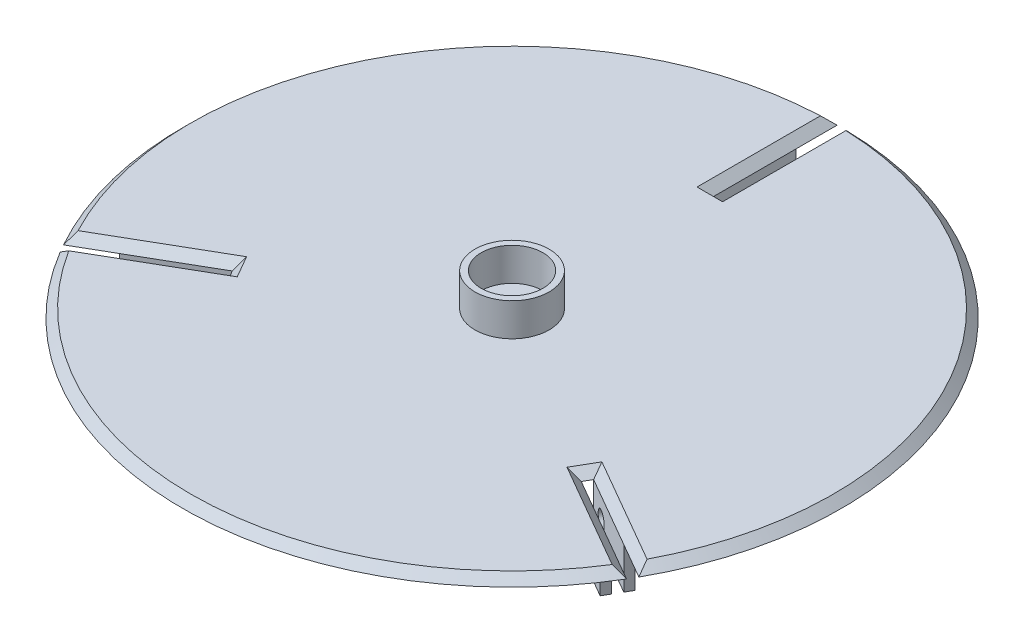
from build123d import *

# Parameters (mm, degrees)
BOSS_EXTRUDE1_DEPTH = 2
BOSS_EXTRUDE1_DRAFT = 45
SKETCH2_R           = 2.5
CUT_EXTRUDE1_DEPTH  = 114.154761278
SKETCH3_R           = 9
SKETCH3_R_2         = 7.5
BOSS_EXTRUDE2_DEPTH = 8
SKETCH4_W           = 2
SKETCH4_H           = 20
BOSS_EXTRUDE3_DEPTH = 10
SKETCH5_R           = 2
CUT_EXTRUDE2_DEPTH  = 10
CIRPATTERN1_COUNT   = 3


# Read off the part's stored shape, not the designer's step: Boss-Extrude1
with BuildPart() as part:
    # Boss-Extrude1 outline → Boss-Extrude1 (with draft: the straight prism first)
    with BuildSketch(Plane(origin=(0, 2, 0), x_dir=(1, 0, 0), z_dir=(0, 1, 0))):
        with BuildLine():
            ThreePointArc((-3.1, 77.938373091), (-67.549981495, 39), (-69.046611026, -36.284507794))
            Line((-69.046611026, -36.284507794), (-43.119219382, -21.315321248))
            Line((-43.119219382, -21.315321248), (-40.019219382, -26.684678752))
            Line((-40.019219382, -26.684678752), (-65.946611026, -41.653865297))
            ThreePointArc((-65.946611026, -41.653865297), (0, -78), (65.946611026, -41.653865297))
            Line((65.946611026, -41.653865297), (40.019219382, -26.684678752))
            Line((40.019219382, -26.684678752), (43.119219382, -21.315321248))
            Line((43.119219382, -21.315321248), (69.046611026, -36.284507794))
            ThreePointArc((69.046611026, -36.284507794), (67.549981495, 39), (3.1, 77.938373091))
            Line((3.1, 77.938373091), (3.1, 48))
            Line((3.1, 48), (-3.1, 48))
            Line((-3.1, 48), (-3.1, 77.938373091))
        make_face()
    extrude(amount=-BOSS_EXTRUDE1_DEPTH)
    # Boss-Extrude1: the draft: its side faces are tilted about the plane it starts from
    boss_extrude1_sides = [part.faces().sort_by_distance(p)[0] for p in [
        (67.549981495, 1, -39),
        (3.1, 1, -62.969186546),
        (0, 1, -48),
        (-3.1, 1, -62.969186546),
        (-67.549981495, 1, -39),
        (-56.082915204, 1, 28.799914521),
        (-41.569219382, 1, 24),
        (-52.982915204, 1, 34.169272025),
        (0, 1, 78),
        (52.982915204, 1, 34.169272025),
        (41.569219382, 1, 24),
        (56.082915204, 1, 28.799914521),
    ]]
    draft(boss_extrude1_sides, Plane(origin=(0, 2, 0), x_dir=(1, 0, 0), z_dir=(0, 1, 0)), BOSS_EXTRUDE1_DRAFT)

    # Sketch2 → Cut-Extrude1 (cut, through all)
    with BuildSketch(Plane(origin=(0, 2, 0), x_dir=(1, 0, 0), z_dir=(0, 1, 0))):
        with Locations(Location((0, 0, 0), (0, 0, 270))):
            Circle(SKETCH2_R)
    extrude(amount=-CUT_EXTRUDE1_DEPTH, mode=Mode.SUBTRACT)

    # Sketch3 → Boss-Extrude2 (add)
    with BuildSketch(Plane(origin=(0, 2, 0), x_dir=(1, 0, 0), z_dir=(0, 1, 0))):
        with Locations(Location((0, 0, 0), (0, 0, 270))):
            Circle(SKETCH3_R)
        with Locations(Location((0, 0, 0), (0, 0, 270))):
            Circle(SKETCH3_R_2, mode=Mode.SUBTRACT)
    extrude(amount=BOSS_EXTRUDE2_DEPTH)

    # Sketch4 → Boss-Extrude3 (add)
    with BuildSketch(Plane.XZ):
        Polygon((42.751270189, 25.952627944), (60.071778265, 35.952627944), (59.071778265, 37.684678752), (41.751270189, 27.684678752), align=None)
        Polygon((43.851270189, 24.047372056), (61.171778265, 34.047372056), (62.171778265, 32.315321248), (44.851270189, 22.315321248), align=None)
        with Locations((2.1, -60)):
            Rectangle(SKETCH4_W, SKETCH4_H)
        with Locations((-2.1, -60)):
            Rectangle(SKETCH4_W, SKETCH4_H)
        Polygon((-44.851270189, 22.315321248), (-62.171778265, 32.315321248), (-61.171778265, 34.047372056), (-43.851270189, 24.047372056), align=None)
        Polygon((-42.751270189, 25.952627944), (-60.071778265, 35.952627944), (-59.071778265, 37.684678752), (-41.751270189, 27.684678752), align=None)
    extrude(amount=BOSS_EXTRUDE3_DEPTH)

    # Sketch5 → Cut-Extrude2 (cut)
    with BuildSketch(Plane(origin=(3.1, 0, 0), x_dir=(0, 0, -1), z_dir=(1, 0, 0))):
        with Locations((55, -5)):
            Circle(SKETCH5_R)
    cut_extrude2 = extrude(amount=-CUT_EXTRUDE2_DEPTH, mode=Mode.SUBTRACT)

    # CirPattern1: Cut-Extrude2 ×3 about axis
    cirpattern1_axis = Axis((0, 10, 0), (0, -1, 0))
    for i in range(1, CIRPATTERN1_COUNT):
        add(cut_extrude2.rotate(cirpattern1_axis, i * 360 / CIRPATTERN1_COUNT), mode=Mode.SUBTRACT)


solid = part.part
